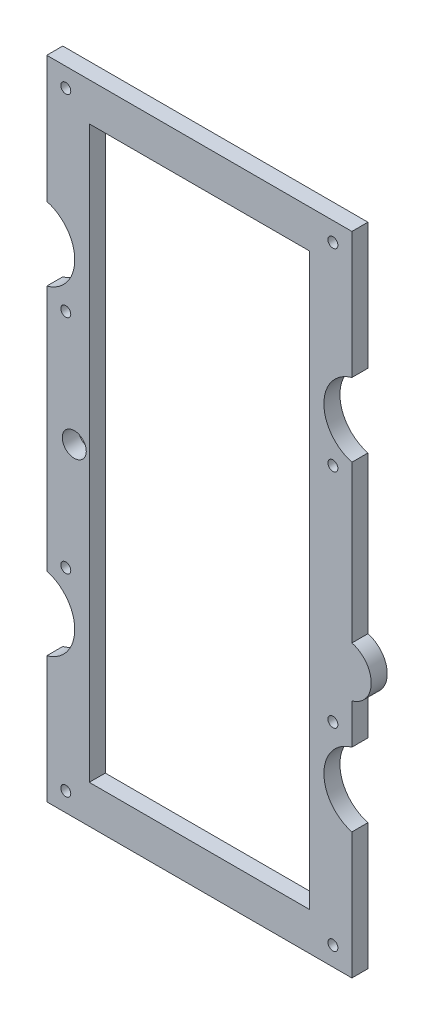
from build123d import *

# Parameters (mm, degrees)
SKETCH1_R           = 2.5
BOSS_EXTRUDE1_DEPTH = 8
SKETCH5_W           = 110
SKETCH5_H           = 285
CUT_EXTRUDE4_DEPTH  = 1166.980256999
SKETCH6_R           = 6
CUT_EXTRUDE5_DEPTH  = 1166.980256999


with BuildPart() as part:
    # Sketch1 → Boss-Extrude1 (new body)
    with BuildSketch(Plane.XY):
        with BuildLine():
            Line((-61.080112923, -938.33030278), (-61.080112923, -1061.66969722))
            ThreePointArc((-61.080112923, -1061.66969722), (-47.080112923, -1080), (-61.080112923, -1098.33030278))
            Line((-61.080112923, -1098.33030278), (-61.080112923, -1161.56262))
            Line((-61.080112923, -1161.56262), (91.419887077, -1161.56262))
            Line((91.419887077, -1161.56262), (91.419887077, -1098.33030278))
            ThreePointArc((91.419887077, -1098.33030278), (77.419887077, -1080), (91.419887077, -1061.66969722))
            Line((91.419887077, -1061.66969722), (91.419887077, -1041.596868336))
            ThreePointArc((91.419887077, -1041.596868336), (101.085308187, -1029.0799835), (91.419887077, -1016.563098664))
            Line((91.419887077, -1016.563098664), (91.419887077, -938.33030278))
            ThreePointArc((91.419887077, -938.33030278), (77.419887077, -920), (91.419887077, -901.66969722))
            Line((91.419887077, -901.66969722), (91.419887077, -838.43738))
            Line((91.419887077, -838.43738), (-61.080112923, -838.43738))
            Line((-61.080112923, -838.43738), (-61.080112923, -901.66969722))
            ThreePointArc((-61.080112923, -901.66969722), (-47.080112923, -920), (-61.080112923, -938.33030278))
        make_face()
        with Locations((-51.580112923, -847.93738)):
            Circle(SKETCH1_R, mode=Mode.SUBTRACT)
        with Locations((81.919887077, -847.93738)):
            Circle(SKETCH1_R, mode=Mode.SUBTRACT)
        with Locations((81.919887077, -944.535688293)):
            Circle(SKETCH1_R, mode=Mode.SUBTRACT)
        with Locations((-51.580112923, -944.535688293)):
            Circle(SKETCH1_R, mode=Mode.SUBTRACT)
        with Locations((-51.580112923, -1055.464311707)):
            Circle(SKETCH1_R, mode=Mode.SUBTRACT)
        with Locations((81.919887077, -1055.464311707)):
            Circle(SKETCH1_R, mode=Mode.SUBTRACT)
        with Locations((81.919887077, -1152.06262)):
            Circle(SKETCH1_R, mode=Mode.SUBTRACT)
        with Locations((-51.580112923, -1152.06262)):
            Circle(SKETCH1_R, mode=Mode.SUBTRACT)
    extrude(amount=BOSS_EXTRUDE1_DEPTH)

    # Sketch5 → Cut-Extrude4 (cut, through all)
    with BuildSketch(Plane(origin=(0, 0, 0), x_dir=(-1, 0, 0), z_dir=(0, 0, -1))):
        with Locations((-15.169887077, -1000)):
            Rectangle(SKETCH5_W, SKETCH5_H)
    extrude(amount=-CUT_EXTRUDE4_DEPTH, mode=Mode.SUBTRACT)

    # Sketch6 → Cut-Extrude5 (cut, through all)
    with BuildSketch(Plane.XY.offset(8)):
        with Locations((-47.330112923, -1000)):
            Circle(SKETCH6_R)
    extrude(amount=-CUT_EXTRUDE5_DEPTH, mode=Mode.SUBTRACT)


solid = part.part
